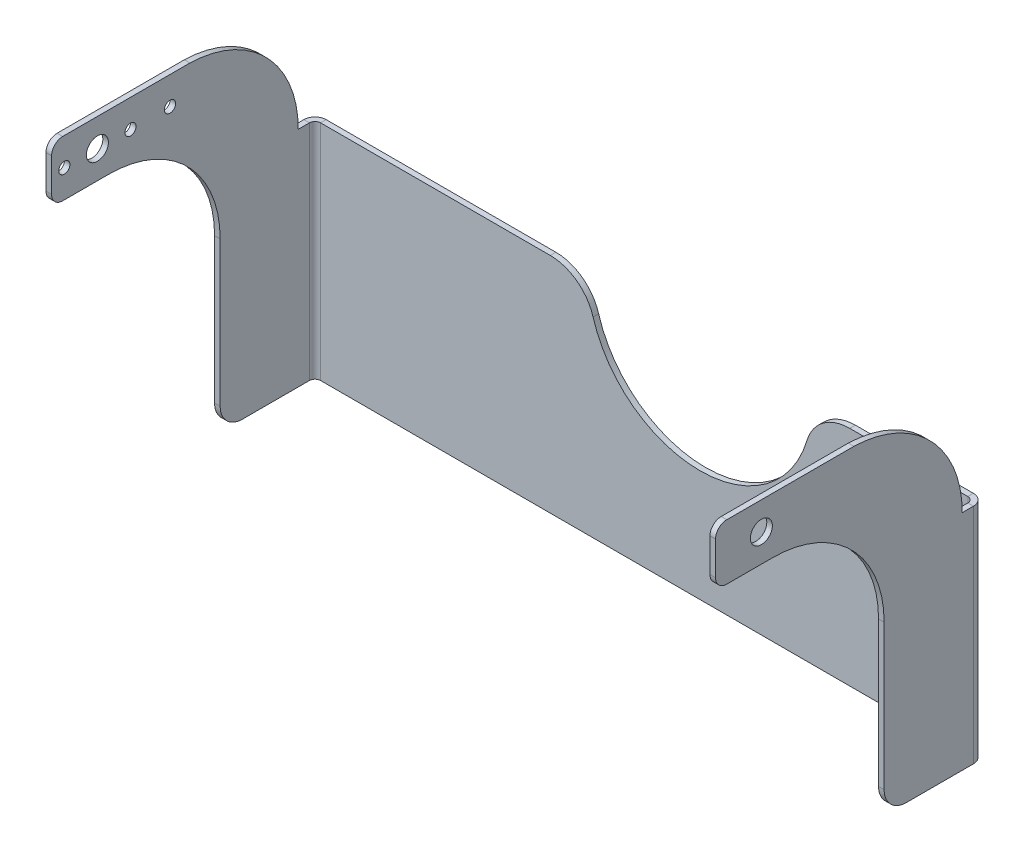
from build123d import *

# Parameters (mm, degrees)
BOSS_EXTRUDE1_DEPTH    = 76.2
CONVERT_SOLID1_DEPTH   = 76.2
CONVERT_SOLID1_2_DEPTH = 76.2
SKETCH6_R              = 2.5019
CUT_EXTRUDE1_DEPTH     = 182.836327504
SKETCH8_W              = 48.26
SKETCH8_H              = 63.5
CUT_EXTRUDE2_DEPTH     = 182.836327504
CUT_EXTRUDE4_DEPTH     = 182.836327504
FILLET1_R              = 25.4
FILLET2_R              = 5.08
FILLET3_R              = 5.08
SKETCH12_R             = 1.27
CUT_EXTRUDE5_DEPTH     = 181.773247191
CUT_EXTRUDE7_DEPTH     = 130.115972676
FILLET4_R              = 10.16
CUT_EXTRUDE8_DEPTH     = 182.836327504


# Read off the part's stored shape, not the designer's step: Convert-Solid1
with BuildPart() as part:
    # Sketch1 → Boss-Extrude1 (new body)
    with BuildSketch(Plane(origin=(0, 0, 0), x_dir=(1, 0, 0), z_dir=(0, 1, 0))):
        Polygon((-76.2, -7.62), (-76.2, 63.5), (76.2, 63.5), (76.2, -7.62), (74.93, -7.62), (74.93, 62.23), (-74.93, 62.23), (-74.93, -7.62), align=None)
    extrude(amount=BOSS_EXTRUDE1_DEPTH)

    # Convert-Solid1 outline → Convert-Solid1 (cut)
    with BuildSketch(Plane(origin=(0, 0, 0), x_dir=(1, 0, 0), z_dir=(0, 1, 0))):
        with BuildLine():
            Line((76.2, 63.5), (73.66, 63.5))
            ThreePointArc((73.66, 63.5), (75.456051224, 62.756051224), (76.2, 60.96))
            Line((76.2, 60.96), (76.2, 63.5))
        make_face()
        with BuildLine():
            ThreePointArc((-76.2, 60.96), (-75.456051224, 62.756051224), (-73.66, 63.5))
            Line((-73.66, 63.5), (-76.2, 63.5))
            Line((-76.2, 63.5), (-76.2, 60.96))
        make_face()
    extrude(amount=CONVERT_SOLID1_DEPTH, mode=Mode.SUBTRACT)

    # Convert-Solid1 2 outline → Convert-Solid1 2 (add)
    with BuildSketch(Plane(origin=(0, 0, 0), x_dir=(1, 0, 0), z_dir=(0, 1, 0))):
        with BuildLine():
            Line((74.93, 62.23), (73.66, 62.23))
            ThreePointArc((73.66, 62.23), (74.558025612, 61.858025612), (74.93, 60.96))
            Line((74.93, 60.96), (74.93, 62.23))
        make_face()
        with BuildLine():
            ThreePointArc((-74.93, 60.96), (-74.558025612, 61.858025612), (-73.66, 62.23))
            Line((-73.66, 62.23), (-74.93, 62.23))
            Line((-74.93, 62.23), (-74.93, 60.96))
        make_face()
    extrude(amount=CONVERT_SOLID1_2_DEPTH)

    # Sketch6 → Cut-Extrude1 (cut, through all)
    with BuildSketch(Plane.ZY.offset(76.2)):
        with Locations((-12.7, 69.85)):
            Circle(SKETCH6_R)
    extrude(amount=-CUT_EXTRUDE1_DEPTH, mode=Mode.SUBTRACT)

    # Sketch8 → Cut-Extrude2 (cut, through all)
    with BuildSketch(Plane.ZY.offset(76.2)):
        with Locations((-16.51, 31.75)):
            Rectangle(SKETCH8_W, SKETCH8_H)
    extrude(amount=-CUT_EXTRUDE2_DEPTH, mode=Mode.SUBTRACT)

    # Sketch10 → Cut-Extrude4 (cut, through all)
    with BuildSketch(Plane.ZY.offset(76.2)):
        with BuildLine():
            Line((-60.96, 50.8), (-58.42, 50.8))
            ThreePointArc((-58.42, 50.8), (-51.241342053, 68.500358158), (-33.761315614, 76.2))
            Line((-33.761315614, 76.2), (-33.761315614, 89.340618928))
            Line((-33.761315614, 89.340618928), (-74.373162464, 89.340618928))
            Line((-74.373162464, 89.340618928), (-74.373162464, 50.8))
            Line((-74.373162464, 50.8), (-60.96, 50.8))
        make_face()
    extrude(amount=-CUT_EXTRUDE4_DEPTH, mode=Mode.SUBTRACT)

    # Fillet1
    fillet1_edges = [part.edges().sort_by_distance(p)[0] for p in [
        (75.565, 63.5, -40.64),
        (-75.565, 63.5, -40.64),
    ]]
    fillet(fillet1_edges, radius=FILLET1_R)

    # Fillet2
    fillet2_edges = [part.edges().sort_by_distance(p)[0] for p in [
        (75.565, 76.2, 7.62),
        (-75.565, 76.2, 7.62),
        (75.565, 63.5, 7.62),
        (-75.565, 63.5, 7.62),
    ]]
    fillet(fillet2_edges, radius=FILLET2_R)

    # Fillet3
    fillet3_edges = [part.edges().sort_by_distance(p)[0] for p in [
        (75.565, 0, -40.64),
        (-75.565, 0, -40.64),
    ]]
    fillet(fillet3_edges, radius=FILLET3_R)

    # Sketch12 → Cut-Extrude5 (cut, through all)
    with BuildSketch(Plane(origin=(-74.93, 0, 0), x_dir=(0, 0, -1), z_dir=(1, 0, 0))):
        with Locations((29.23, 69.85)):
            Circle(SKETCH12_R)
        with Locations((20.23, 69.85)):
            Circle(SKETCH12_R)
        with Locations((5.17, 69.85)):
            Circle(SKETCH12_R)
    extrude(amount=-CUT_EXTRUDE5_DEPTH, mode=Mode.SUBTRACT)

    # Sketch14 → Cut-Extrude7 (cut, through all)
    with BuildSketch(Plane(origin=(0, 0, -63.5), x_dir=(-1, 0, 0), z_dir=(0, 0, -1))):
        with BuildLine():
            Line((12.7, 50.8), (1.071870333, 91.408147598))
            Line((1.071870333, 91.408147598), (-38.1, 50.8))
            ThreePointArc((-38.1, 50.8), (-12.7, 25.4), (12.7, 50.8))
        make_face()
    extrude(amount=-CUT_EXTRUDE7_DEPTH, mode=Mode.SUBTRACT)

    # Fillet4
    fillet4_edges = [part.edges().sort_by_distance(p)[0] for p in [
        (-12.7, 50.8, -62.865),
        (38.1, 50.8, -62.865),
    ]]
    fillet(fillet4_edges, radius=FILLET4_R)

    # Sketch15 → Cut-Extrude8 (cut, through all)
    with BuildSketch(Plane.ZY.offset(76.2)):
        with BuildLine():
            Line((-5.770454057, 63.5), (-4.809684624, 63.5))
            ThreePointArc((-4.809684624, 63.5), (-3.0136334, 64.243948776), (-2.269684624, 66.04))
            Line((-2.269684624, 66.04), (-2.269684624, 73.66))
            ThreePointArc((-2.269684624, 73.66), (-3.0136334, 75.456051224), (-4.809684624, 76.2))
            Line((-4.809684624, 76.2), (-5.770454057, 76.2))
            Line((-5.770454057, 76.2), (-1.678645629, 79.389355871))
            Line((-1.678645629, 79.389355871), (6.777461653, 78.341276838))
            Line((6.777461653, 78.341276838), (9.50563074, 68.386937654))
            Line((9.50563074, 68.386937654), (3.09513087, 60.066927184))
            Line((3.09513087, 60.066927184), (-5.770454057, 60.066927184))
            Line((-5.770454057, 60.066927184), (-5.770454057, 63.5))
        make_face()
    extrude(amount=-CUT_EXTRUDE8_DEPTH, mode=Mode.SUBTRACT)


solid = part.part
